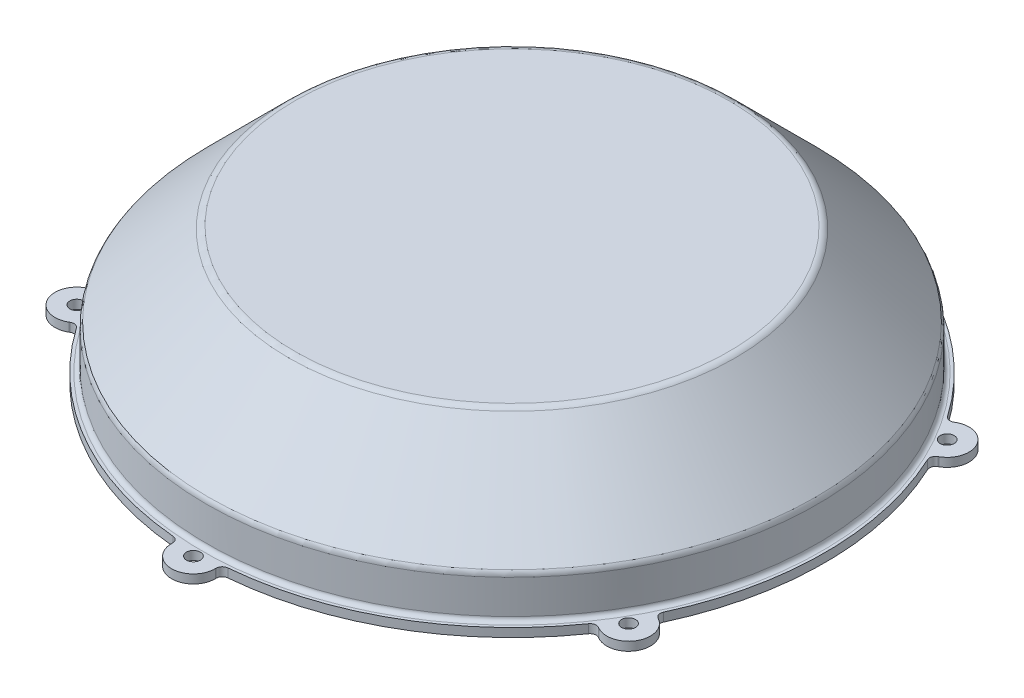
from build123d import *
from build123d.topology import SkipClean

# Parameters (mm, degrees)
SKETCH_1_R      = 70
SKETCH_1_R_2    = 67.5
EXTRUDE_1_DEPTH = 10
EXTRUDE_START   = 2
SKETCH_2_R      = 67.5
SKETCH_2_R_2    = 1.6
EXTRUDE_2_DEPTH = 2
FILLET_1_R      = 1
FILLET_2_R      = 2


with BuildPart() as part:
    # Эскиз1 → Бобышка-Вытянуть1 (new body)
    with BuildSketch(Plane(origin=(0, 0, 0), x_dir=(1, 0, 0), z_dir=(0, 1, 0))):
        with Locations(Location((0, 0, 0), (0, 0, 270))):
            Circle(SKETCH_1_R)
        with Locations(Location((0, 0, 0), (0, 0, 270))):
            Circle(SKETCH_1_R_2, mode=Mode.SUBTRACT)
    extrude(amount=EXTRUDE_1_DEPTH)

    # Эскиз2 → Бобышка-Вытянуть2 (add)
    with SkipClean():  # the faces are left unmerged after this step: merging them gives an invalid solid
        with BuildSketch(Plane.XZ.offset(EXTRUDE_START)):
            with BuildLine():
                Line((-5, 73), (-5, 72.783842909))
                ThreePointArc((-5, 72.783842909), (-5.367603881, 71.838243495), (-6.277368932, 71.389224101))
                ThreePointArc((-6.277368932, 71.389224101), (-35.832341113, 62.063435361), (-58.686197162, 41.130973015))
                ThreePointArc((-58.686197162, 41.130973015), (-59.52994189, 40.567603065), (-60.532656944, 40.722048474))
                Line((-60.532656944, 40.722048474), (-60.719854476, 40.830127019))
                ThreePointArc((-60.719854476, 40.830127019), (-67.549981495, 39), (-65.719854476, 32.169872981))
                Line((-65.719854476, 32.169872981), (-65.532656944, 32.061794436))
                ThreePointArc((-65.532656944, 32.061794436), (-64.89754577, 31.270640429), (-64.963566094, 30.258251086))
                ThreePointArc((-64.963566094, 30.258251086), (-71.664682225, 0), (-64.963566094, -30.258251086))
                ThreePointArc((-64.963566094, -30.258251086), (-64.89754577, -31.270640429), (-65.532656944, -32.061794436))
                Line((-65.532656944, -32.061794436), (-65.719854476, -32.169872981))
                ThreePointArc((-65.719854476, -32.169872981), (-67.549981495, -39), (-60.719854476, -40.830127019))
                Line((-60.719854476, -40.830127019), (-60.532656944, -40.722048474))
                ThreePointArc((-60.532656944, -40.722048474), (-59.52994189, -40.567603065), (-58.686197162, -41.130973015))
                ThreePointArc((-58.686197162, -41.130973015), (-35.832341113, -62.063435361), (-6.277368932, -71.389224101))
                ThreePointArc((-6.277368932, -71.389224101), (-5.367603881, -71.838243495), (-5, -72.783842909))
                Line((-5, -72.783842909), (-5, -73))
                ThreePointArc((-5, -73), (0, -78), (5, -73))
                Line((5, -73), (5, -72.783842909))
                ThreePointArc((5, -72.783842909), (5.367603881, -71.838243495), (6.277368932, -71.389224101))
                ThreePointArc((6.277368932, -71.389224101), (35.832341113, -62.063435361), (58.686197162, -41.130973015))
                ThreePointArc((58.686197162, -41.130973015), (59.52994189, -40.567603065), (60.532656944, -40.722048474))
                Line((60.532656944, -40.722048474), (60.719854476, -40.830127019))
                ThreePointArc((60.719854476, -40.830127019), (67.549981495, -39), (65.719854476, -32.169872981))
                Line((65.719854476, -32.169872981), (65.532656944, -32.061794436))
                ThreePointArc((65.532656944, -32.061794436), (64.89754577, -31.270640429), (64.963566094, -30.258251086))
                ThreePointArc((64.963566094, -30.258251086), (71.664682225, 0), (64.963566094, 30.258251086))
                ThreePointArc((64.963566094, 30.258251086), (64.89754577, 31.270640429), (65.532656944, 32.061794436))
                Line((65.532656944, 32.061794436), (65.719854476, 32.169872981))
                ThreePointArc((65.719854476, 32.169872981), (67.549981495, 39), (60.719854476, 40.830127019))
                Line((60.719854476, 40.830127019), (60.532656944, 40.722048474))
                ThreePointArc((60.532656944, 40.722048474), (59.52994189, 40.567603065), (58.686197162, 41.130973015))
                ThreePointArc((58.686197162, 41.130973015), (35.832341113, 62.063435361), (6.277368932, 71.389224101))
                ThreePointArc((6.277368932, 71.389224101), (5.367603881, 71.838243495), (5, 72.783842909))
                Line((5, 72.783842909), (5, 73))
                ThreePointArc((5, 73), (0, 78), (-5, 73))
            make_face()
            with Locations(Location((0, 0, 0), (0, 0, 270))):
                Circle(SKETCH_2_R, mode=Mode.SUBTRACT)
            with Locations(Location((0, 73, 0), (0, 0, 270))):
                Circle(SKETCH_2_R_2, mode=Mode.SUBTRACT)
            with Locations(Location((63.219854476, 36.5, 0), (0, 0, 270))):
                Circle(SKETCH_2_R_2, mode=Mode.SUBTRACT)
            with Locations(Location((63.219854476, -36.5, 0), (0, 0, 270))):
                Circle(SKETCH_2_R_2, mode=Mode.SUBTRACT)
            with Locations(Location((0, -73, 0), (0, 0, 270))):
                Circle(SKETCH_2_R_2, mode=Mode.SUBTRACT)
            with Locations(Location((-63.219854476, -36.5, 0), (0, 0, 270))):
                Circle(SKETCH_2_R_2, mode=Mode.SUBTRACT)
            with Locations(Location((-63.219854476, 36.5, 0), (0, 0, 270))):
                Circle(SKETCH_2_R_2, mode=Mode.SUBTRACT)
        extrude(amount=-EXTRUDE_2_DEPTH)

    # Скругление1
    fillet_1_edges = [part.edges().sort_by_distance(p)[0] for p in [
        (0, 0, -70),
    ]]
    fillet(fillet_1_edges, radius=FILLET_1_R)

    # Эскиз3 → Повернуть1 (revolve)
    with BuildSketch(Plane.XY, mode=Mode.PRIVATE) as revolve_1_sk:
        Polygon((-69.584637185, 10), (-50.584637185, 29), (0, 29), (0, 27), (-49.756210061, 27), (-66.756210061, 10), align=None)
    revolve(revolve_1_sk.sketch.rotate(Axis((0, 27, 0), (0, -1, 0)), 90), axis=Axis((0, 27, 0), (0, -1, 0)))

    # Скругление2
    # the kernel refuses this fillet: 2 mm, written as the material it takes off along each edge
    with BuildSketch(Plane(origin=(0, 29, 0), x_dir=(0, 0, -1), z_dir=(-1, 0, 0))) as fillet_2_piece_1:
        with BuildLine():
            CenterArc((50.584637185 - FILLET_2_R * 0.414213562373, FILLET_2_R), FILLET_2_R, 270, 45)
            Line((50.584637185 - FILLET_2_R * 0.414213562373, 0), (50.584637185 - FILLET_2_R * 0.414213562373, -FILLET_2_R * 0.02))
            Line((50.584637185 - FILLET_2_R * 0.414213562373, -FILLET_2_R * 0.02), (50.584637185 + FILLET_2_R * 0.00828427124746, -FILLET_2_R * 0.02))
            Line((50.584637185 + FILLET_2_R * 0.00828427124746, -FILLET_2_R * 0.02), (50.584637185 + FILLET_2_R * 0.307035354437, FILLET_2_R * 0.27875108319))
            Line((50.584637185 + FILLET_2_R * 0.307035354437, FILLET_2_R * 0.27875108319), (50.584637185 + FILLET_2_R * 0.292893218813, FILLET_2_R * 0.292893218813))
        make_face()
    revolve(axis=Axis((0, 29, 0), (0, -1, 0)), mode=Mode.SUBTRACT)
    with BuildSketch(Plane(origin=(0, 10, 0), x_dir=(0, 0, 1), z_dir=(-1, 0, 0))) as fillet_2_piece_2:
        with BuildLine():
            CenterArc((68, -1.220215141), FILLET_2_R, 0, 37.597281425)
            Line((69.584637185, 0), (69.616329929, 0.024404303))
            ThreePointArc((69.616329929, 0.024404303), (69.792318593, 0.04), (70, 0.04))
            Line((70, 0.04), (70.04, 0))
            Line((70.04, 0), (70.04, -1.220215141))
            Line((70.04, -1.220215141), (70, -1.220215141))
        make_face()
    revolve(axis=Axis((0, 10, 0), (0, 1, 0)), mode=Mode.SUBTRACT)


solid = part.part
